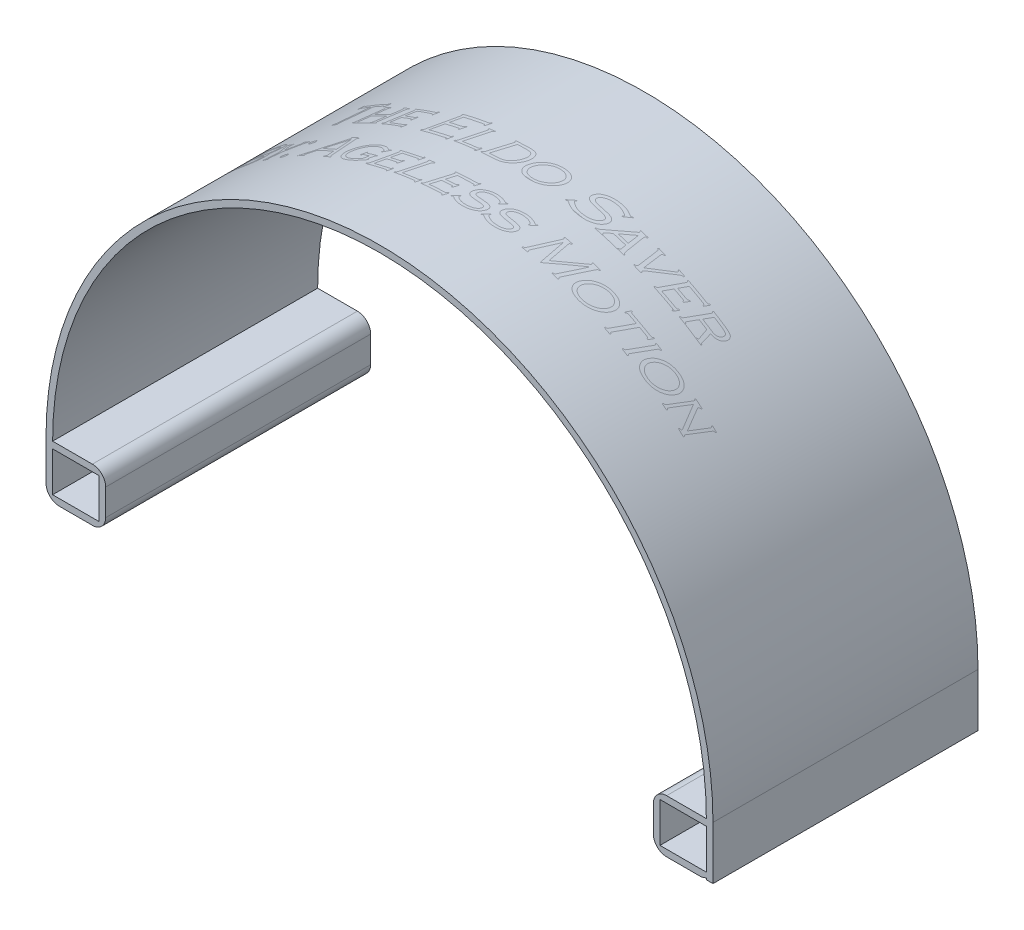
from build123d import *

# Parameters (mm, degrees)
BOSS_EXTRUDE2_DEPTH = 30
SKETCH4_W           = 1.5
SKETCH4_H           = 60
BOSS_EXTRUDE3_DEPTH = 12
SKETCH5_W           = 60
SKETCH5_H           = 1.5
BOSS_EXTRUDE4_DEPTH = 12
SKETCH6_W           = 1.5
SKETCH6_H           = 60
BOSS_EXTRUDE5_DEPTH = 10.5
BOSS_EXTRUDE6_REACH = 163.001
SKETCH9_W           = 60
SKETCH9_H           = 1.5
FILLET1_R           = 3
FILLET3_R           = 3


with BuildPart() as part:
    # Sketch1 → Boss-Extrude2 (new, symmetric)
    with BuildSketch(Plane.XY):
        with BuildLine():
            Line((-74, 0), (-75.5, 0))
            ThreePointArc((-75.5, 0), (0, 75.5), (75.5, 0))
            Line((75.5, 0), (74, 0))
            ThreePointArc((74, 0), (0, 74), (-74, 0))
        make_face()
    extrude(amount=BOSS_EXTRUDE2_DEPTH, both=True)

    # Sketch4 → Boss-Extrude3 (add)
    with BuildSketch(Plane.XZ):
        with Locations((-74.75, 0)):
            Rectangle(SKETCH4_W, SKETCH4_H)
        with Locations((74.75, 0)):
            Rectangle(SKETCH4_W, SKETCH4_H)
    boss_extrude3 = extrude(amount=BOSS_EXTRUDE3_DEPTH)

    # Sketch5 → Boss-Extrude4 (add)
    with BuildSketch(Plane.ZY.offset(-74)):
        with Locations((0, -11.25)):
            Rectangle(SKETCH5_W, SKETCH5_H)
    boss_extrude4 = extrude(amount=BOSS_EXTRUDE4_DEPTH)

    # Sketch6 → Boss-Extrude5 (add)
    with BuildSketch(Plane(origin=(0, -10.5, 0), x_dir=(1, 0, 0), z_dir=(0, 1, 0))):
        with Locations((62.75, 0)):
            Rectangle(SKETCH6_W, SKETCH6_H)
    boss_extrude5 = extrude(amount=BOSS_EXTRUDE5_DEPTH)

    # Sketch9 → Boss-Extrude6 (add, up to next)
    with BuildSketch(Plane(origin=(63.5, 0, 0), x_dir=(0, 0, -1), z_dir=(1, 0, 0)), mode=Mode.PRIVATE) as boss_extrude6_sk1:
        with Locations((0, -0.75)):
            Rectangle(SKETCH9_W, SKETCH9_H)
    boss_extrude6_tool1 = extrude(boss_extrude6_sk1.sketch, amount=BOSS_EXTRUDE6_REACH, mode=Mode.PRIVATE) - part.part
    boss_extrude6 = boss_extrude6_tool1.solids().sort_by_distance((63.5, -0.75, 0))[0]
    add(boss_extrude6)

    # Fillet1
    fillet1_edges = [part.edges().sort_by_distance(p)[0] for p in [
        (62, -12, 0),
        (75.5, -12, 0),
        (62, 0, 0),
    ]]
    fillet(fillet1_edges, radius=FILLET1_R)

    # Mirror11: Boss-Extrude3, Boss-Extrude4, Boss-Extrude5, Boss-Extrude6 across plane
    add(boss_extrude3.mirror(Plane(origin=(0, 0, 0), x_dir=(0, 0, 1), z_dir=(1, 0, 0))))
    add(boss_extrude4.mirror(Plane(origin=(0, 0, 0), x_dir=(0, 0, 1), z_dir=(1, 0, 0))))
    add(boss_extrude5.mirror(Plane(origin=(0, 0, 0), x_dir=(0, 0, 1), z_dir=(1, 0, 0))))
    add(boss_extrude6.mirror(Plane(origin=(0, 0, 0), x_dir=(0, 0, 1), z_dir=(1, 0, 0))))

    # Fillet3
    fillet3_edges = [part.edges().sort_by_distance(p)[0] for p in [
        (-75.5, -12, 0),
        (-62, -12, 0),
        (-62, 0, 0),
    ]]
    fillet(fillet3_edges, radius=FILLET3_R)


solid = part.part
